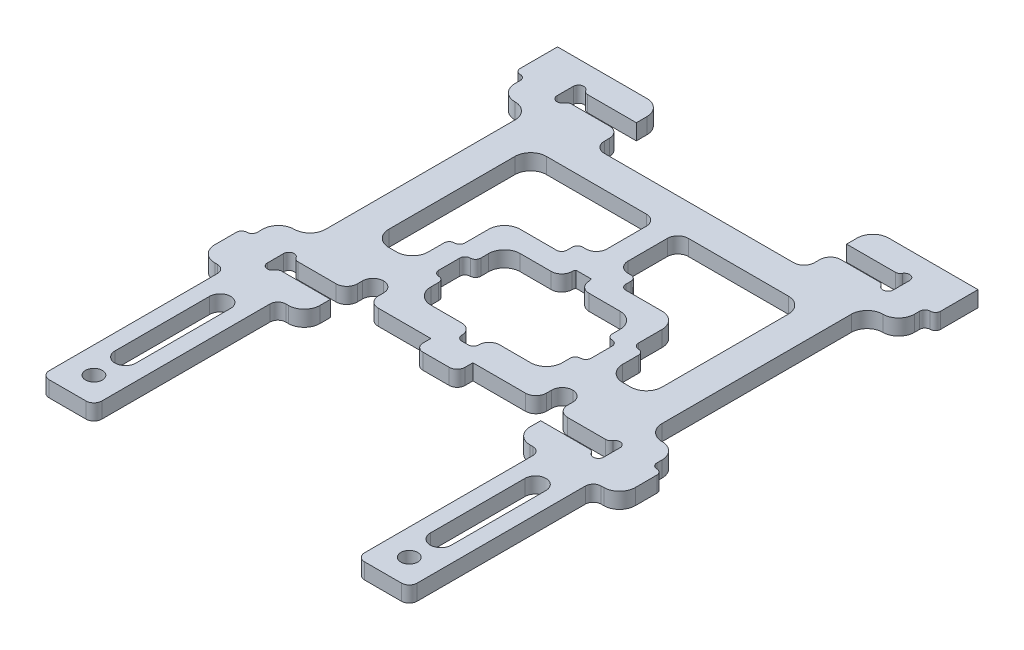
from build123d import *

# Parameters (mm, degrees)
EXTRUDE_1_DEPTH      = 3
FILLET_4_R           = 3
SKETCH_9_W           = 32
SKETCH_9_H           = 5
EXTRUDE_2_DEPTH      = 3
FILLET_12_R          = 2
SKETCH_6_W           = 25
SKETCH_6_H           = 17
CUT_EXTRUDE_6_DEPTH  = 3
FILLET_14_R          = 3
SKETCH_10_W          = 3.2
SKETCH_10_H          = 23
CUT_EXTRUDE_7_DEPTH  = 3
FILLET_15_R          = 2
SKETCH_12_W          = 8
SKETCH_12_H          = 3
EXTRUDE_3_DEPTH      = 3
FILLET_17_R          = 1
FILLET_18_R          = 1.5
SKETCH_15_W          = 29
SKETCH_15_H          = 6
CUT_EXTRUDE_10_DEPTH = 10
FILLET_24_R          = 1
FILLET_26_R          = 2
SKETCH_20_W          = 5.090560833
SKETCH_20_H          = 52
CUT_EXTRUDE_14_DEPTH = 10
FILLET_28_R          = 1
SKETCH_21_W          = 6
SKETCH_21_H          = 42
CUT_EXTRUDE_15_DEPTH = 6
FILLET_29_R          = 3
FILLET_30_R          = 1
MIRROR_7_DEPTH       = 3
SKETCH_22_W          = 4
SKETCH_22_H          = 17.677995627
EXTRUDE_4_DEPTH      = 3
FILLET_31_R          = 2
SKETCH_25_W          = 10
SKETCH_25_H          = 35
EXTRUDE_6_DEPTH      = 3
FILLET_32_R          = 1.5
HOLE_WIZARD_M3_1_D   = 3.2
CUT_EXTRUDE_17_DEPTH = 10
SKETCH_29_R          = 1
CUT_EXTRUDE_18_DEPTH = 10
FILLET_33_R          = 1
FILLET_34_R          = 1


with BuildPart() as part:
    # 草图1 → 凸台-拉伸1 (new body)
    with BuildSketch(Plane(origin=(0, 0, 0), x_dir=(1, 0, 0), z_dir=(0, 1, 0))):
        Polygon((-20, 34.1), (-40, 34.1), (-40, -34.1), (-20, -34.1), (-20, -29.1), (-32, -29.1), (-32, -26), (-20, -26), (-20, -21), (20, -21), (20, -26), (32, -26), (32, -29.1), (20, -29.1), (20, -34.1), (40, -34.1), (40, 34.1), (20, 34.1), (20, 29.1), (32, 29.1), (32, 26), (20, 26), (20, 21), (-20, 21), (-20, 26), (-32, 26), (-32, 29.1), (-20, 29.1), align=None)
    extrude(amount=EXTRUDE_1_DEPTH)

    # 圆角4
    fillet_4_edges = [part.edges().sort_by_distance(p)[0] for p in [
        (20, 1.5, -34.1),
        (40, 1.5, 34.1),
        (20, 1.5, 34.1),
        (-20, 1.5, 34.1),
        (-40, 1.5, 34.1),
        (-20, 1.5, -34.1),
    ]]
    fillet(fillet_4_edges, radius=FILLET_4_R)

    # 草图9 → 凸台-拉伸2 (add)
    with BuildSketch(Plane(origin=(0, 3, 0), x_dir=(1, 0, 0), z_dir=(0, 1, 0))):
        with Locations((0, -23.5)):
            Rectangle(SKETCH_9_W, SKETCH_9_H)
    extrude(amount=-EXTRUDE_2_DEPTH)

    # 圆角12
    fillet_12_edges = [part.edges().sort_by_distance(p)[0] for p in [
        (-20, 1.5, -21),
        (20, 1.5, -21),
        (20, 1.5, -26),
        (20, 1.5, 26),
        (20, 1.5, 21),
        (-20, 1.5, 21),
        (-20, 1.5, 26),
        (-20, 1.5, -26),
    ]]
    fillet(fillet_12_edges, radius=FILLET_12_R)

    # 草图6 → 切除-拉伸6 (cut)
    with BuildSketch(Plane(origin=(0, 3, 0), x_dir=(1, 0, 0), z_dir=(0, 1, 0))):
        with Locations((0, -12)):
            Rectangle(SKETCH_6_W, SKETCH_6_H)
    extrude(amount=-CUT_EXTRUDE_6_DEPTH, mode=Mode.SUBTRACT)

    # 圆角14
    fillet_14_edges = [part.edges().sort_by_distance(p)[0] for p in [
        (12.5, 1.5, 3.5),
        (12.5, 1.5, 20.5),
        (-12.5, 1.5, 20.5),
        (-12.5, 1.5, 3.5),
    ]]
    fillet(fillet_14_edges, radius=FILLET_14_R)

    # 草图10 → 切除-拉伸7 (cut)
    with BuildSketch(Plane(origin=(0, 3, 0), x_dir=(1, 0, 0), z_dir=(0, 1, 0))):
        with Locations((0, -12)):
            Rectangle(SKETCH_10_W, SKETCH_10_H)
    extrude(amount=-CUT_EXTRUDE_7_DEPTH, mode=Mode.SUBTRACT)

    # 圆角15
    fillet_15_edges = [part.edges().sort_by_distance(p)[0] for p in [
        (-1.6, 1.5, 3.5),
        (1.6, 1.5, 3.5),
        (1.6, 1.5, 20.5),
        (-1.6, 1.5, 20.5),
    ]]
    fillet(fillet_15_edges, radius=FILLET_15_R)

    # 草图12 → 凸台-拉伸3 (add)
    with BuildSketch(Plane(origin=(0, 3, 0), x_dir=(1, 0, 0), z_dir=(0, 1, 0))):
        with Locations((0, -27.5)):
            Rectangle(SKETCH_12_W, SKETCH_12_H)
    extrude(amount=-EXTRUDE_3_DEPTH)

    # 圆角17
    fillet_17_edges = [part.edges().sort_by_distance(p)[0] for p in [
        (1.6, 1.5, 23.5),
        (-1.6, 1.5, 23.5),
        (1.6, 1.5, 0.5),
        (-1.6, 1.5, 0.5),
    ]]
    fillet(fillet_17_edges, radius=FILLET_17_R - 0.0001)  # a hair under: the kernel refuses the full size

    # 圆角18
    fillet_18_edges = [part.edges().sort_by_distance(p)[0] for p in [
        (4, 1.5, 29),
        (-4, 1.5, 29),
    ]]
    fillet(fillet_18_edges, radius=FILLET_18_R)

    # 草图15 → 切除-拉伸10 (cut)
    with BuildSketch(Plane(origin=(0, 3, 0), x_dir=(1, 0, 0), z_dir=(0, 1, 0))):
        with Locations((0, -12)):
            Rectangle(SKETCH_15_W, SKETCH_15_H)
    extrude(amount=-CUT_EXTRUDE_10_DEPTH, mode=Mode.SUBTRACT)

    # 圆角24
    fillet_24_edges = [part.edges().sort_by_distance(p)[0] for p in [
        (14.5, 1.5, 15),
        (14.5, 1.5, 9),
        (-14.5, 1.5, 15),
        (-14.5, 1.5, 9),
    ]]
    fillet(fillet_24_edges, radius=FILLET_24_R)
    fillet_24_2_edges = [part.edges().sort_by_distance(p)[0] for p in [
        (12.5, 1.5, 15),
        (12.5, 1.5, 9),
        (-12.5, 1.5, 15),
        (-12.5, 1.5, 9),
    ]]
    fillet(fillet_24_2_edges, radius=FILLET_24_R - 0.0001)  # a hair under: the kernel refuses the full size

    # 圆角26
    fillet_26_edges = [part.edges().sort_by_distance(p)[0] for p in [
        (16, 1.5, 21),
        (-16, 1.5, 21),
    ]]
    fillet(fillet_26_edges, radius=FILLET_26_R - 0.0001)  # a hair under: the kernel refuses the full size
    fillet_26_2_edges = [part.edges().sort_by_distance(p)[0] for p in [
        (16, 1.5, 26),
        (-16, 1.5, 26),
    ]]
    fillet(fillet_26_2_edges, radius=FILLET_26_R)

    # 草图20 → 切除-拉伸14 (cut)
    with BuildSketch(Plane(origin=(0, 3, 0), x_dir=(1, 0, 0), z_dir=(0, 1, 0))):
        with Locations((-40.545280417, 0)):
            Rectangle(SKETCH_20_W, SKETCH_20_H)
    extrude(amount=-CUT_EXTRUDE_14_DEPTH, mode=Mode.SUBTRACT)

    # 圆角28
    fillet_28_edges = [part.edges().sort_by_distance(p)[0] for p in [
        (-38, 1.5, -26),
        (-38, 1.5, 26),
    ]]
    fillet(fillet_28_edges, radius=FILLET_28_R)
    fillet_28_2_edges = [part.edges().sort_by_distance(p)[0] for p in [
        (-40, 1.5, -26),
        (-40, 1.5, 26),
    ]]
    fillet(fillet_28_2_edges, radius=FILLET_28_R - 0.0001)  # a hair under: the kernel refuses the full size

    # 草图21 → 切除-拉伸15 (cut)
    with BuildSketch(Plane(origin=(0, 3, 0), x_dir=(1, 0, 0), z_dir=(0, 1, 0))):
        with Locations((-35, 0)):
            Rectangle(SKETCH_21_W, SKETCH_21_H)
        Polygon((-5.6, 3.5), (0, 3.5), (0, 15), (-26, 15), (-26, -15), (-18.5, -15), (-18.5, -8), (-16.5, -8), (-16.5, 0.5), (-5.6, 0.5), align=None)
    extrude(amount=-CUT_EXTRUDE_15_DEPTH, mode=Mode.SUBTRACT)

    # 圆角29
    fillet_29_edges = [part.edges().sort_by_distance(p)[0] for p in [
        (-18.5, 1.5, 15),
        (-16.5, 1.5, -0.5),
        (-32, 1.5, 21),
        (-38, 1.5, 21),
        (-32, 1.5, -21),
        (-38, 1.5, -21),
        (-26, 1.5, -15),
        (-26, 1.5, 15),
    ]]
    fillet(fillet_29_edges, radius=FILLET_29_R - 0.0001)  # a hair under: the kernel refuses the full size

    # 圆角30
    fillet_30_edges = [part.edges().sort_by_distance(p)[0] for p in [
        (-16.5, 1.5, 8),
        (-5.6, 1.5, -0.5),
    ]]
    fillet(fillet_30_edges, radius=FILLET_30_R)
    fillet_30_2_edges = [part.edges().sort_by_distance(p)[0] for p in [
        (-18.5, 1.5, 8),
        (-5.6, 1.5, -3.5),
    ]]
    fillet(fillet_30_2_edges, radius=FILLET_30_R - 0.0001)  # a hair under: the kernel refuses the full size

    # 镜向7: read off the stored shape, not the designer's step
    # 镜向7 outline → 镜向7 (cut)
    with BuildSketch(Plane(origin=(0, 0, 0), x_dir=(1, 0, 0), z_dir=(0, 1, 0))):
        with BuildLine():
            Line((38, -24), (38, -25))
            ThreePointArc((38, -25), (38.292893219, -25.707106781), (39, -26))
            Line((39, -26), (40, -26))
            Line((40, -26), (40, 26))
            Line((40, 26), (39, 26))
            ThreePointArc((39, 26), (38.292893219, 25.707106781), (38, 25))
            Line((38, 25), (38, 24))
            ThreePointArc((38, 24), (37.121320344, 21.878679656), (35, 21))
            ThreePointArc((35, 21), (32.878679656, 20.121320344), (32, 18))
            Line((32, 18), (32, -18))
            ThreePointArc((32, -18), (32.878679656, -20.121320344), (35, -21))
            ThreePointArc((35, -21), (37.121320344, -21.878679656), (38, -24))
        make_face()
        with BuildLine():
            Line((21.5, -15), (23, -15))
            ThreePointArc((23, -15), (25.121320344, -14.121320344), (26, -12))
            Line((26, -12), (26, 12))
            ThreePointArc((26, 12), (25.121320344, 14.121320344), (23, 15))
            Line((23, 15), (0, 15))
            Line((0, 15), (0, 3.5))
            Line((0, 3.5), (4.6, 3.5))
            ThreePointArc((4.6, 3.5), (5.307106781, 3.207106781), (5.6, 2.5))
            Line((5.6, 2.5), (5.6, 1.5))
            ThreePointArc((5.6, 1.5), (5.892893219, 0.792893219), (6.6, 0.5))
            Line((6.6, 0.5), (13.5, 0.5))
            ThreePointArc((13.5, 0.5), (15.621320344, -0.378679656), (16.5, -2.5))
            Line((16.5, -2.5), (16.5, -7))
            ThreePointArc((16.5, -7), (16.792893219, -7.707106781), (17.5, -8))
            ThreePointArc((17.5, -8), (18.207106781, -8.292893219), (18.5, -9))
            Line((18.5, -9), (18.5, -12))
            ThreePointArc((18.5, -12), (19.378679656, -14.121320344), (21.5, -15))
        make_face()
    extrude(amount=MIRROR_7_DEPTH, mode=Mode.SUBTRACT)

    # 草图22 → 凸台-拉伸4 (add)
    with BuildSketch(Plane(origin=(0, 3, 0), x_dir=(1, 0, 0), z_dir=(0, 1, 0))):
        with Locations((0.001338689, 7.903416032)):
            Rectangle(SKETCH_22_W, SKETCH_22_H)
    extrude(amount=-EXTRUDE_4_DEPTH)

    # 圆角31
    fillet_31_edges = [part.edges().sort_by_distance(p)[0] for p in [
        (-1.998661311, 1.5, -3.5),
        (2.001338689, 1.5, -3.5),
        (2.001338689, 1.5, -15),
        (-1.998661311, 1.5, -15),
    ]]
    fillet(fillet_31_edges, radius=FILLET_31_R)

    # 草图25 → 凸台-拉伸6 (add)
    with BuildSketch(Plane(origin=(0, 3, 0), x_dir=(1, 0, 0), z_dir=(0, 1, 0))):
        with Locations((-30, -51.6)):
            Rectangle(SKETCH_25_W, SKETCH_25_H)
    extrude_6 = extrude(amount=-EXTRUDE_6_DEPTH)

    # 镜向9: 凸台-拉伸6 across plane
    add(extrude_6.mirror(Plane(origin=(0, 0, 0), x_dir=(0, 0, 1), z_dir=(1, 0, 0))))

    # 圆角32
    fillet_32_edges = [part.edges().sort_by_distance(p)[0] for p in [
        (-35, 1.5, 69.1),
        (-35, 1.5, 34.1),
        (-25, 1.5, 34.1),
        (-25, 1.5, 69.1),
        (25, 1.5, 34.1),
        (25, 1.5, 69.1),
        (35, 1.5, 69.1),
        (35, 1.5, 34.1),
    ]]
    fillet(fillet_32_edges, radius=FILLET_32_R)

    # M3 间隙孔1 (through all)
    with Locations(Plane(origin=(0, 3, 0), x_dir=(1, 0, 0), z_dir=(0, 1, 0))):
        with Locations((-30, -64.1)):
            hole_wizard_m3_1 = Hole(HOLE_WIZARD_M3_1_D / 2)

    # 镜向10: M3 间隙孔1 across plane
    add(hole_wizard_m3_1.mirror(Plane(origin=(0, 0, 0), x_dir=(0, 0, 1), z_dir=(1, 0, 0))), mode=Mode.SUBTRACT)

    # 草图28 → 切除-拉伸17 (cut)
    with BuildSketch(Plane(origin=(0, 3, 0), x_dir=(1, 0, 0), z_dir=(0, 1, 0))):
        with BuildLine():
            Line((-28, -40.1), (-28, -58.1))
            ThreePointArc((-28, -58.1), (-30, -60.1), (-32, -58.1))
            Line((-32, -58.1), (-32, -40.1))
            ThreePointArc((-32, -40.1), (-30, -38.1), (-28, -40.1))
        make_face()
    cut_extrude_17 = extrude(amount=-CUT_EXTRUDE_17_DEPTH, mode=Mode.SUBTRACT)

    # 镜向11: 切除-拉伸17 across plane
    add(cut_extrude_17.mirror(Plane(origin=(0, 0, 0), x_dir=(0, 0, 1), z_dir=(1, 0, 0))), mode=Mode.SUBTRACT)

    # 草图29 → 切除-拉伸18 (cut)
    with BuildSketch(Plane.XZ):
        with Locations((31, -29.1)):
            Circle(SKETCH_29_R)
        with Locations((31, -26)):
            Circle(SKETCH_29_R)
        with Locations((31, 26)):
            Circle(SKETCH_29_R)
        with Locations((31, 29.1)):
            Circle(SKETCH_29_R)
    cut_extrude_18 = extrude(amount=-CUT_EXTRUDE_18_DEPTH, mode=Mode.SUBTRACT)

    # 镜向13: 切除-拉伸18 across plane
    add(cut_extrude_18.mirror(Plane(origin=(0, 0, 0), x_dir=(0, 0, 1), z_dir=(1, 0, 0))), mode=Mode.SUBTRACT)

    # 圆角33
    fillet_33_edges = [part.edges().sort_by_distance(p)[0] for p in [
        (30, 1.5, -26),
        (30, 1.5, 29.1),
        (30, 1.5, -29.1),
        (30, 1.5, 26),
        (-30, 1.5, 26),
        (-30, 1.5, -29.1),
        (-30, 1.5, -26),
        (-30, 1.5, 29.1),
    ]]
    fillet(fillet_33_edges, radius=FILLET_33_R)

    # 圆角34
    fillet_34_edges = [part.edges().sort_by_distance(p)[0] for p in [
        (40, 1.5, 26),
        (40, 1.5, -26),
    ]]
    fillet(fillet_34_edges, radius=FILLET_34_R - 0.0001)  # a hair under: the kernel refuses the full size


solid = part.part
